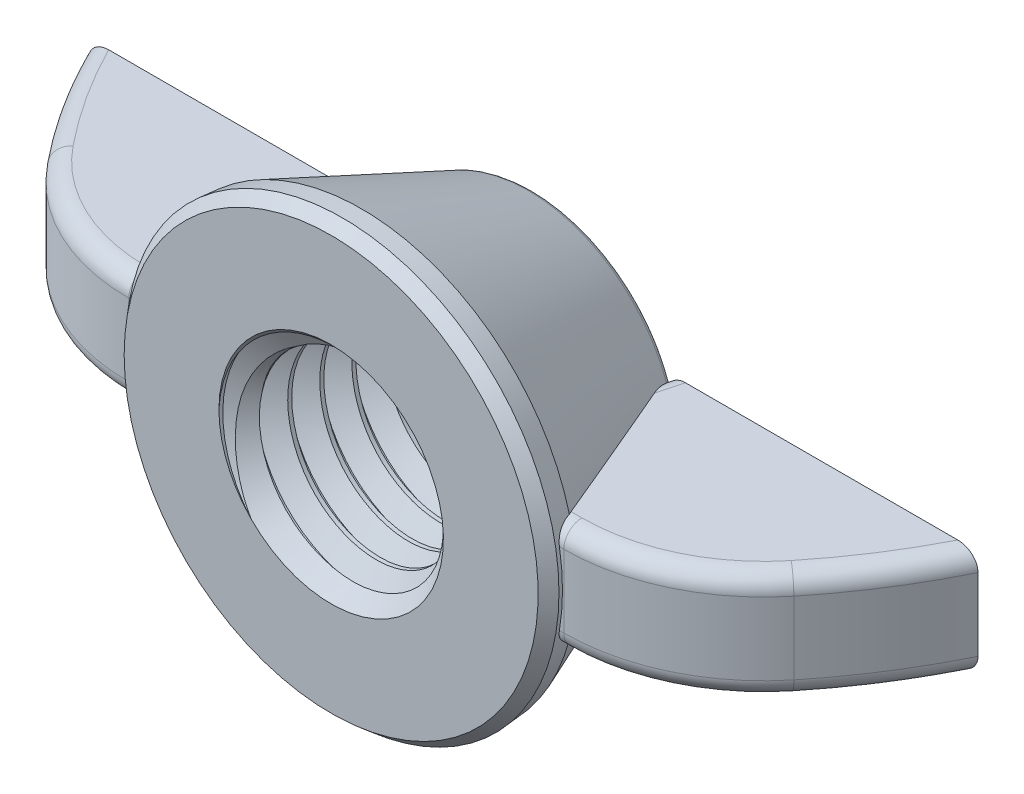
from build123d import *

# Parameters (mm, degrees)
EXTRUDE2_DEPTH     = 1.537890625
SKETCH3_R          = 6.1515625
EXTRUDE1_DEPTH     = 0.85725
EXTRUDE1_DRAFT     = -5
SKETCH15_R         = 6.076562843
EXTRUDE3_DEPTH     = 4.85775
EXTRUDE3_TAPER     = 21.960198558
FILLET3_R          = 0.254
SKETCH4_R          = 3.175
CUT_EXTRUDE1_DEPTH = 23.225885864
SWEEP1_PITCH       = 0.907142857
SKETCH7_R          = 6.1515625
CUT_EXTRUDE2_DEPTH = 23.225885892
SKETCH8_R          = 6.076562843
CUT_EXTRUDE3_DEPTH = 19.579558086
SKETCH11_R         = 3.1242
CUT_EXTRUDE5_DEPTH = 19.579558053
CUT_EXTRUDE5_TAPER = 45
CHAMFER1_SIZE      = 0.32146875
CHAMFER1_SIZE2     = 0.296735699
FILLET4_R          = 0.512630208
SKETCH16_R         = 15.79655202
CUT_EXTRUDE6_DEPTH = 19.57030039


with BuildPart() as part:
    # Sketch13 → Extrude2 (new, symmetric)
    with BuildSketch(Plane(origin=(0, 0, 0), x_dir=(1, 0, 0), z_dir=(0, 1, 0))):
        with BuildLine():
            Line((3.773545526, 0.428625), (6.1515625, 0.428625))
            ThreePointArc((6.1515625, 0.428625), (8.590910612, 0.981496101), (10.553521716, 2.53205836))
            ThreePointArc((10.553521716, 2.53205836), (13.326559198, 7.495965423), (14.2875, 13.10013378))
            ThreePointArc((14.2875, 13.10013378), (14.187492334, 13.501242622), (13.91088161, 13.808449953))
            ThreePointArc((13.91088161, 13.808449953), (10.685615281, 15.346823078), (7.151500977, 15.875))
            ThreePointArc((7.151500977, 15.875), (6.631385147, 15.698444466), (6.326229714, 15.241747088))
            Line((6.326229714, 15.241747088), (3.773545526, 5.715))
            Line((3.773545526, 5.715), (3.773545526, 0.428625))
        make_face()
    extrude(amount=EXTRUDE2_DEPTH, both=True)

    # Fillet4
    fillet4_edges = [part.edges().sort_by_distance(p)[0] for p in [
        (8.590910612, 1.537890625, -0.981496101),
        (4.962554013, -1.537890625, -0.428625),
        (13.326559198, 1.537890625, -7.495965423),
        (14.187492334, 1.537890625, -13.501242622),
        (10.685615281, 1.537890625, -15.346823078),
        (6.631385147, 1.537890625, -15.698444466),
        (5.04988762, 1.537890625, -10.478373544),
        (4.962554013, 1.537890625, -0.428625),
        (5.04988762, -1.537890625, -10.478373544),
        (6.631385147, -1.537890625, -15.698444466),
        (10.685615281, -1.537890625, -15.346823078),
        (14.187492334, -1.537890625, -13.501242622),
        (13.326559198, -1.537890625, -7.495965423),
        (8.590910612, -1.537890625, -0.981496101),
    ]]
    fillet(fillet4_edges, radius=FILLET4_R)


with BuildPart() as body_2:
    # Sketch3 → Extrude1 (with draft: the straight prism first)
    with BuildSketch(Plane.XY):
        Circle(SKETCH3_R)
    extrude(amount=-EXTRUDE1_DEPTH)
    # Extrude1: the draft: its side faces are tilted about the plane it starts from
    extrude1_sides = [body_2.faces().sort_by_distance(p)[0] for p in [
        (-6.1515625, 0, -0.428625),
    ]]
    draft(extrude1_sides, Plane.XY, EXTRUDE1_DRAFT)

    # Sketch15 → Extrude3 (add)
    with BuildSketch(Plane(origin=(0, 0, -0.85725), x_dir=(-1, 0, 0), z_dir=(0, 0, -1))):
        Circle(SKETCH15_R)
    extrude(amount=EXTRUDE3_DEPTH, taper=EXTRUDE3_TAPER)

    # Fillet3
    fillet3_edges = [body_2.edges().sort_by_distance(p)[0] for p in [
        (4.117828705, 0, -5.715),
    ]]
    fillet(fillet3_edges, radius=FILLET3_R)

    # Sketch4 → Cut-Extrude1 (cut, through all)
    with BuildSketch(Plane.XY):
        Circle(SKETCH4_R)
    extrude(amount=-CUT_EXTRUDE1_DEPTH, mode=Mode.SUBTRACT)

    # Sweep1: the profile of Sketch6 profile screwed along a right-hand helix of 9.8 turns, 6 arcs to a turn; built about Z, then put on its axis
    sweep1_z = Axis((0, 0, 0), (0, 0, 1))
    sweep1_corners = [(3.1753, 0, -0.793923205), (2.585793431, 0, -0.453571429), (2.585793431, 0, -0.340178571), (3.1753, 0, 0.000173205)]
    with BuildLine(mode=Mode.PRIVATE) as sweep1_profile:
        Line(sweep1_corners[0], sweep1_corners[1])
        Line(sweep1_corners[1], sweep1_corners[2])
        Line(sweep1_corners[2], sweep1_corners[3])
        Line(sweep1_corners[3], sweep1_corners[0])
    sweep1_cap = Face(sweep1_profile.wire())
    sweep1_turn_angles = [0, 30, 60, 90, 120, 150, 180, 210, 240, 270, 300, 330, 360]
    sweep1_turn_weights = [1, 0.8660254037844387, 1, 0.8660254037844387, 1, 0.8660254037844387, 1, 0.8660254037844387, 1, 0.8660254037844387, 1, 0.8660254037844387, 1]
    sweep1_turn_rails = [Edge.make_bspline([Vector(p[0], p[1], 0).rotate(sweep1_z, sweep1_turn_angles[k]) / sweep1_turn_weights[k] + Vector(0, 0, p[2] + SWEEP1_PITCH * sweep1_turn_angles[k] / 360) for k in range(13)], [0, 0, 0, 1, 1, 2, 2, 3, 3, 4, 4, 5, 5, 6, 6, 6], 2, sweep1_turn_weights) for p in sweep1_corners]
    sweep1_turn_sides = [Face.make_surface_from_curves(sweep1_turn_rails[p[0]], sweep1_turn_rails[p[1]]) for p in [(0, 1), (1, 2), (2, 3), (3, 0)]]
    sweep1_last_angles = [3240, 3270, 3300, 3330, 3360, 3390, 3420, 3450, 3480, 3504, 3528]
    sweep1_last_weights = [1, 0.8660254037844387, 1, 0.8660254037844387, 1, 0.8660254037844387, 1, 0.8660254037844387, 1, 0.9135454576425137, 1]
    sweep1_last_rails = [Edge.make_bspline([Vector(p[0], p[1], 0).rotate(sweep1_z, sweep1_last_angles[k]) / sweep1_last_weights[k] + Vector(0, 0, p[2] + SWEEP1_PITCH * sweep1_last_angles[k] / 360) for k in range(11)], [0, 0, 0, 1, 1, 2, 2, 3, 3, 4, 4, 5, 5, 5], 2, sweep1_last_weights) for p in sweep1_corners]
    sweep1_last_sides = [Face.make_surface_from_curves(sweep1_last_rails[p[0]], sweep1_last_rails[p[1]]) for p in [(0, 1), (1, 2), (2, 3), (3, 0)]]
    sweep1 = Plane(origin=(0, 0, 0), x_dir=(-1, 0, 0), z_dir=(0, 0, -1)) * Solid(Shell([*[p.moved(Location((0, 0, SWEEP1_PITCH * i))) for i in range(9) for p in sweep1_turn_sides], *sweep1_last_sides, sweep1_cap, sweep1_cap.rotate(sweep1_z, 3528).moved(Location((0, 0, SWEEP1_PITCH * 3528 / 360)))]))
    add(sweep1)

    # Sketch7 → Cut-Extrude2 (cut, through all)
    with BuildSketch(Plane.XY):
        Circle(SKETCH7_R)
    extrude(amount=CUT_EXTRUDE2_DEPTH, mode=Mode.SUBTRACT)

    # Sketch8 → Cut-Extrude3 (cut, through all)
    with BuildSketch(Plane.XY.offset(-5.715)):
        Circle(SKETCH8_R)
    extrude(amount=-CUT_EXTRUDE3_DEPTH, mode=Mode.SUBTRACT)

    # Cut-Extrude4 cone 1 section (through the dimple's axis) → Cut-Extrude4 (revolve, cut)
    with BuildSketch(Plane(origin=(0, 0, 0), x_dir=(0, -1, 0), z_dir=(1, 0, 0))):
        Polygon((0, 0), (3.175, 0), (0, 3.175), align=None)
    revolve(axis=Axis((0, 0, 0), (0, 0, -1)), mode=Mode.SUBTRACT)

    # Sketch11 → Cut-Extrude5 (cut, through all)
    with BuildSketch(Plane.XY.offset(-5.715)):
        Circle(SKETCH11_R)
    extrude(amount=CUT_EXTRUDE5_DEPTH, taper=CUT_EXTRUDE5_TAPER, mode=Mode.SUBTRACT)

    # Chamfer1
    chamfer1_edges = [body_2.edges().sort_by_distance(p)[0] for p in [
        (-6.1515625, 0, 0),
    ]]
    chamfer1_side = [body_2.faces().sort_by_distance(p)[0] for p in [
        (-6.114062672, 0, -0.428625),
    ]]
    chamfer(chamfer1_edges, length=CHAMFER1_SIZE, length2=CHAMFER1_SIZE2, reference=chamfer1_side[0])


with BuildPart() as body_3:
    # Mirror6: mirrored copy
    add(part.part.mirror(Plane(origin=(0, 0, 0), x_dir=(0, 0, 1), z_dir=(1, 0, 0))))

    # Combine2: union part, body 2
    add(part.part)
    add(body_2.part)

    # Sketch16 → Cut-Extrude6 (cut, through all)
    with BuildSketch(Plane(origin=(0, 0, -5.715), x_dir=(-1, 0, 0), z_dir=(0, 0, -1))):
        Circle(SKETCH16_R)
    extrude(amount=CUT_EXTRUDE6_DEPTH, mode=Mode.SUBTRACT)


solid = body_3.part
